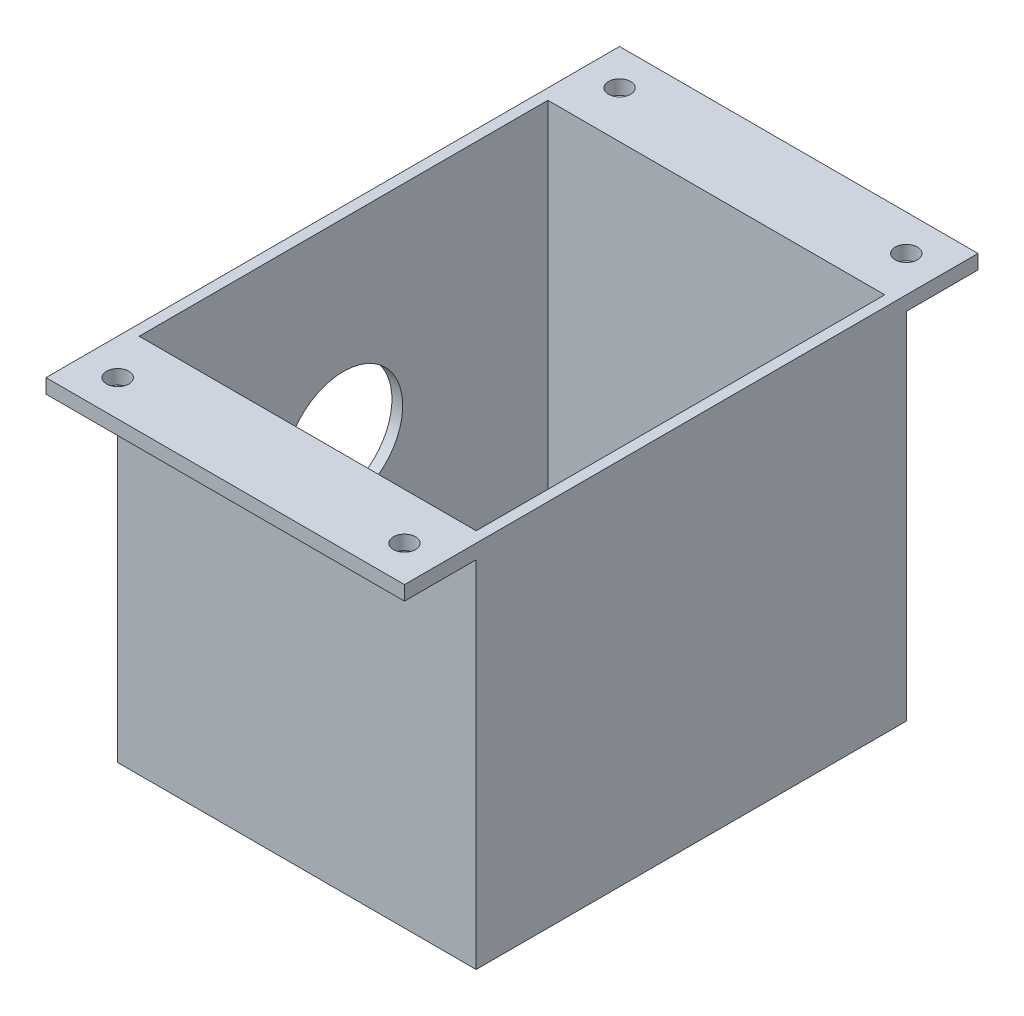
from build123d import *

# Parameters (mm, degrees)
SKETCH1_W           = 50
SKETCH1_H           = 60
SKETCH1_W_2         = 47
SKETCH1_H_2         = 57
BOSS_EXTRUDE6_DEPTH = 50
SKETCH7_W           = 50
SKETCH7_H           = 60
BOSS_EXTRUDE8_DEPTH = 1.5
SKETCH8_W           = 10
SKETCH8_H           = 2
BOSS_EXTRUDE9_DEPTH = 50
SKETCH9_R           = 1.55
CUT_EXTRUDE1_DEPTH  = 3
SKETCH11_R          = 8.25
CUT_EXTRUDE3_DEPTH  = 1.5


with BuildPart() as part:
    # Sketch1 → Boss-Extrude6 (new body)
    with BuildSketch(Plane(origin=(0, 0, 0), x_dir=(1, 0, 0), z_dir=(0, 1, 0))):
        Rectangle(SKETCH1_W, SKETCH1_H)
        Rectangle(SKETCH1_W_2, SKETCH1_H_2, mode=Mode.SUBTRACT)
    extrude(amount=BOSS_EXTRUDE6_DEPTH)

    # Sketch7 → Boss-Extrude8 (add)
    with BuildSketch(Plane.XZ):
        Rectangle(SKETCH7_W, SKETCH7_H)
    extrude(amount=BOSS_EXTRUDE8_DEPTH)

    # Sketch8 → Boss-Extrude9 (add)
    with BuildSketch(Plane(origin=(25, 0, 0), x_dir=(0, 0, -1), z_dir=(1, 0, 0))):
        with Locations((-35, 49)):
            Rectangle(SKETCH8_W, SKETCH8_H)
        with Locations((35, 49)):
            Rectangle(SKETCH8_W, SKETCH8_H)
    extrude(amount=-BOSS_EXTRUDE9_DEPTH)

    # Sketch9 → Cut-Extrude1 (cut)
    with BuildSketch(Plane(origin=(0, 50, 0), x_dir=(1, 0, 0), z_dir=(0, 1, 0))):
        with Locations((-20, 35)):
            Circle(SKETCH9_R)
        with Locations((20, 35)):
            Circle(SKETCH9_R)
        with Locations((20, -35)):
            Circle(SKETCH9_R)
        with Locations((-20, -35)):
            Circle(SKETCH9_R)
    extrude(amount=-CUT_EXTRUDE1_DEPTH, mode=Mode.SUBTRACT)

    # Sketch11 → Cut-Extrude3 (cut)
    with BuildSketch(Plane.ZY.offset(25)):
        with Locations((0, 23.25)):
            Circle(SKETCH11_R)
    extrude(amount=-CUT_EXTRUDE3_DEPTH, mode=Mode.SUBTRACT)


solid = part.part
